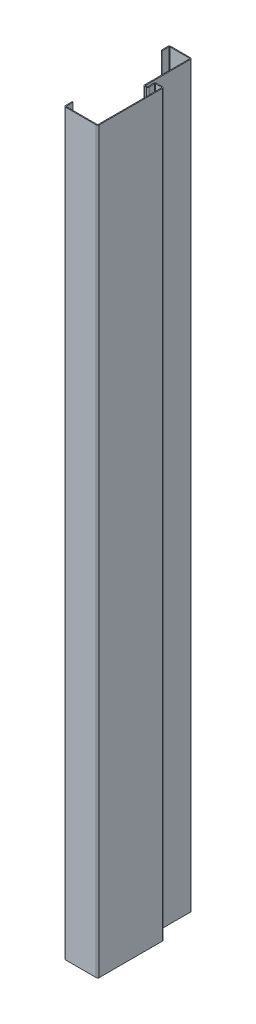
from build123d import *

# Parameters (mm, degrees)
BASE_FLANGE1_DEPTH = 490.75


# Sheet-metal steps are written as plain solids
with BuildPart() as part:
    # Sketch1 → Base-Flange1 (new, symmetric)
    with BuildSketch(Plane(origin=(0, 0, 0), x_dir=(1, 0, 0), z_dir=(0, 1, 0))):
        with BuildLine():
            Line((9.5, 59.25), (9.5, 68.0134))
            ThreePointArc((9.5, 68.0134), (10.081861668, 69.418138332), (11.4866, 70))
            Line((11.4866, 70), (37.5134, 70))
            ThreePointArc((37.5134, 70), (38.918138332, 69.418138332), (39.5, 68.0134))
            Line((39.5, 68.0134), (39.5, 23))
            Line((39.5, 23), (39.5, 8.562771629))
            ThreePointArc((39.5, 8.562771629), (39.724914644, 8.032905932), (40.262306969, 7.826620346))
            Line((40.262306969, 7.826620346), (42.153527557, 7.892663224))
            ThreePointArc((42.153527557, 7.892663224), (42.675221066, 8.135932903), (42.862626267, 8.680197126))
            Line((42.862626267, 8.680197126), (42.359529101, 15.874821789))
            ThreePointArc((42.359529101, 15.874821789), (42.88838258, 17.368257942), (44.341289843, 18))
            Line((44.341289843, 18), (52.2634, 18))
            ThreePointArc((52.2634, 18), (53.668138332, 17.418138332), (54.25, 16.0134))
            Line((54.25, 16.0134), (54.25, -23))
            Line((54.25, -23), (54.25, -68.0134))
            ThreePointArc((54.25, -68.0134), (53.668138332, -69.418138332), (52.2634, -70))
            Line((52.2634, -70), (39.5, -70))
            Line((39.5, -70), (11.4866, -70))
            ThreePointArc((11.4866, -70), (10.081861668, -69.418138332), (9.5, -68.0134))
            Line((9.5, -68.0134), (9.5, -59.25))
            Line((9.5, -59.25), (10.75, -59.25))
            Line((10.75, -59.25), (10.75, -68.0134))
            ThreePointArc((10.75, -68.0134), (10.965745145, -68.534254855), (11.4866, -68.75))
            Line((11.4866, -68.75), (39.5, -68.75))
            Line((39.5, -68.75), (52.2634, -68.75))
            ThreePointArc((52.2634, -68.75), (52.784254855, -68.534254855), (53, -68.0134))
            Line((53, -68.0134), (53, -23))
            Line((53, -23), (53, 16.0134))
            ThreePointArc((53, 16.0134), (52.784254855, 16.534254855), (52.2634, 16.75))
            Line((52.2634, 16.75), (44.341289843, 16.75))
            ThreePointArc((44.341289843, 16.75), (43.802574707, 16.515759992), (43.606484164, 15.962017381))
            Line((43.606484164, 15.962017381), (44.10958133, 8.767392718))
            ThreePointArc((44.10958133, 8.767392718), (43.604152098, 7.299519645), (42.197151928, 6.64342469))
            Line((42.197151928, 6.64342469), (40.30593134, 6.577381812))
            ThreePointArc((40.30593134, 6.577381812), (38.856591681, 7.133731182), (38.25, 8.562771629))
            Line((38.25, 8.562771629), (38.25, 23))
            Line((38.25, 23), (38.25, 68.0134))
            ThreePointArc((38.25, 68.0134), (38.034254855, 68.534254855), (37.5134, 68.75))
            Line((37.5134, 68.75), (11.4866, 68.75))
            ThreePointArc((11.4866, 68.75), (10.965745145, 68.534254855), (10.75, 68.0134))
            Line((10.75, 68.0134), (10.75, 59.25))
            Line((10.75, 59.25), (9.5, 59.25))
        make_face()
    extrude(amount=BASE_FLANGE1_DEPTH, both=True)


solid = part.part
